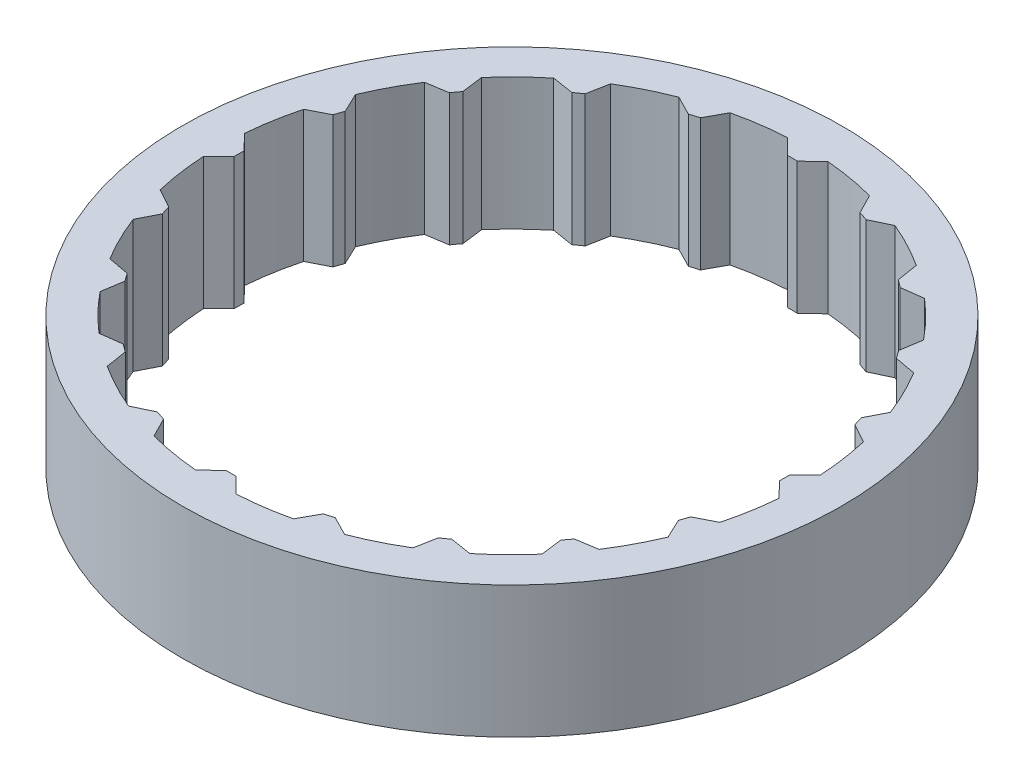
from build123d import *

# Parameters (mm, degrees)
SKETCH1_R           = 62.5
BOSS_EXTRUDE1_DEPTH = 25
CAVITY1_DEPTH       = 25


# Read off the part's stored shape, not the designer's step: Cavity1
with BuildPart() as part:
    # Sketch1 → Boss-Extrude1 (new body)
    with BuildSketch(Plane(origin=(0, 0, 0), x_dir=(1, 0, 0), z_dir=(0, 1, 0))):
        with Locations(Location((0, 0, 0), (0, 0, 270))):
            Circle(SKETCH1_R)
    extrude(amount=BOSS_EXTRUDE1_DEPTH)

    # Cavity1 outline → Cavity1 (cut)
    with BuildSketch(Plane(origin=(0, 0, 0), x_dir=(1, 0, 0), z_dir=(0, 1, 0))):
        with BuildLine():
            Line((16.350867892, -49.873660473), (20.022970331, -51.745036944))
            ThreePointArc((20.022970331, -51.745036944), (24.456878574, -49.800038203), (28.704396647, -47.476000203))
            Line((28.704396647, -47.476000203), (29.464309883, -43.425207924))
            ThreePointArc((29.464309883, -43.425207924), (30.217762384, -42.903777412), (30.961999914, -42.369276757))
            Line((30.961999914, -42.369276757), (35.032663999, -43.014319485))
            ThreePointArc((35.032663999, -43.014319485), (38.648523661, -39.79436276), (41.969986165, -36.271516008))
            Line((41.969986165, -36.271516008), (41.440942946, -32.18415751))
            ThreePointArc((41.440942946, -32.18415751), (41.996387967, -31.455417996), (42.539030133, -30.717095621))
            Line((42.539030133, -30.717095621), (46.609790903, -30.07266333))
            ThreePointArc((46.609790903, -30.07266333), (49.053656447, -25.89294042), (51.12393549, -21.5161257))
            Line((51.12393549, -21.5161257), (49.357722251, -17.792300112))
            ThreePointArc((49.357722251, -17.792300112), (49.660788964, -16.927585698), (49.94871817, -16.05771374))
            Line((49.94871817, -16.05771374), (53.621101197, -14.186887953))
            ThreePointArc((53.621101197, -14.186887953), (54.653750036, -9.456539258), (55.270192281, -4.654189691))
            Line((55.270192281, -4.654189691), (52.43969828, -1.658411006))
            ThreePointArc((52.43969828, -1.658411006), (52.460720403, -0.742365963), (52.465752134, 0.173906448))
            Line((52.465752134, 0.173906448), (55.380278979, 3.087996269))
            ThreePointArc((55.380278979, 3.087996269), (54.900628251, 7.905931261), (54.002892036, 12.66372824))
            Line((54.002892036, 12.66372824), (50.385185747, 14.63821233))
            ThreePointArc((50.385185747, 14.63821233), (50.122105488, 15.515919131), (49.843747202, 16.388900869))
            Line((49.843747202, 16.388900869), (51.715123672, 20.061003308))
            ThreePointArc((51.715123672, 20.061003308), (49.770124931, 24.49491155), (47.446086932, 28.742429624))
            Line((47.446086932, 28.742429624), (43.395294653, 29.50234286))
            ThreePointArc((43.395294653, 29.50234286), (42.87386414, 30.255795361), (42.339363485, 31.000032891))
            Line((42.339363485, 31.000032891), (42.984406214, 35.070696976))
            ThreePointArc((42.984406214, 35.070696976), (39.764449489, 38.686556638), (36.241602736, 42.008019142))
            Line((36.241602736, 42.008019142), (32.154244239, 41.478975923))
            ThreePointArc((32.154244239, 41.478975923), (31.425504725, 42.034420944), (30.68718235, 42.57706311))
            Line((30.68718235, 42.57706311), (30.042750059, 46.64782388))
            ThreePointArc((30.042750059, 46.64782388), (25.863027148, 49.091689424), (21.486212429, 51.161968467))
            Line((21.486212429, 51.161968467), (17.762386841, 49.395755228))
            ThreePointArc((17.762386841, 49.395755228), (16.897672427, 49.698821941), (16.027800469, 49.986751147))
            Line((16.027800469, 49.986751147), (14.156974682, 53.659134174))
            ThreePointArc((14.156974682, 53.659134174), (9.426625987, 54.691783013), (4.62427642, 55.308225258))
            Line((4.62427642, 55.308225258), (1.628497735, 52.477731257))
            ThreePointArc((1.628497735, 52.477731257), (0.712452692, 52.49875338), (-0.20381972, 52.503785111))
            Line((-0.20381972, 52.503785111), (-3.11790954, 55.418311956))
            ThreePointArc((-3.11790954, 55.418311956), (-7.935844532, 54.938661228), (-12.693641511, 54.040925013))
            Line((-12.693641511, 54.040925013), (-14.668125602, 50.423218724))
            ThreePointArc((-14.668125602, 50.423218724), (-15.545832402, 50.160138465), (-16.41881414, 49.881780179))
            Line((-16.41881414, 49.881780179), (-20.090916579, 51.753156649))
            ThreePointArc((-20.090916579, 51.753156649), (-24.524824822, 49.808157908), (-28.772342895, 47.484119909))
            Line((-28.772342895, 47.484119909), (-29.532256132, 43.43332763))
            ThreePointArc((-29.532256132, 43.43332763), (-30.285708633, 42.911897117), (-31.029946162, 42.377396462))
            Line((-31.029946162, 42.377396462), (-35.100610248, 43.022439191))
            ThreePointArc((-35.100610248, 43.022439191), (-38.71646991, 39.802482465), (-42.037932414, 36.279635713))
            Line((-42.037932414, 36.279635713), (-41.508889194, 32.192277216))
            ThreePointArc((-41.508889194, 32.192277216), (-42.064334215, 31.463537702), (-42.606976382, 30.725215327))
            Line((-42.606976382, 30.725215327), (-46.677737151, 30.080783036))
            ThreePointArc((-46.677737151, 30.080783036), (-49.121602695, 25.901060125), (-51.191881738, 21.524245406))
            Line((-51.191881738, 21.524245406), (-49.425668499, 17.800419818))
            ThreePointArc((-49.425668499, 17.800419818), (-49.728735212, 16.935705404), (-50.016664419, 16.065833446))
            Line((-50.016664419, 16.065833446), (-53.689047445, 14.195007659))
            ThreePointArc((-53.689047445, 14.195007659), (-54.721696284, 9.464658964), (-55.33813853, 4.662309397))
            Line((-55.33813853, 4.662309397), (-52.507644528, 1.666530712))
            ThreePointArc((-52.507644528, 1.666530712), (-52.528666651, 0.750485669), (-52.533698382, -0.165786743))
            Line((-52.533698382, -0.165786743), (-55.448225228, -3.079876563))
            ThreePointArc((-55.448225228, -3.079876563), (-54.968574499, -7.897811555), (-54.070838284, -12.655608534))
            Line((-54.070838284, -12.655608534), (-50.453131995, -14.630092625))
            ThreePointArc((-50.453131995, -14.630092625), (-50.190051736, -15.507799425), (-49.91169345, -16.380781163))
            Line((-49.91169345, -16.380781163), (-51.783069921, -20.052883602))
            ThreePointArc((-51.783069921, -20.052883602), (-49.83807118, -24.486791845), (-47.51403318, -28.734309918))
            Line((-47.51403318, -28.734309918), (-43.463240901, -29.494223155))
            ThreePointArc((-43.463240901, -29.494223155), (-42.941810389, -30.247675656), (-42.407309734, -30.991913185))
            Line((-42.407309734, -30.991913185), (-43.052352462, -35.062577271))
            ThreePointArc((-43.052352462, -35.062577271), (-39.832395737, -38.678436932), (-36.309548985, -41.999899437))
            Line((-36.309548985, -41.999899437), (-32.222190487, -41.470856217))
            ThreePointArc((-32.222190487, -41.470856217), (-31.493450973, -42.026301238), (-30.755128598, -42.568943405))
            Line((-30.755128598, -42.568943405), (-30.110696307, -46.639704174))
            ThreePointArc((-30.110696307, -46.639704174), (-25.930973397, -49.083569718), (-21.554158677, -51.153848761))
            Line((-21.554158677, -51.153848761), (-17.830333089, -49.387635522))
            ThreePointArc((-17.830333089, -49.387635522), (-16.965618675, -49.690702235), (-16.095746717, -49.978631442))
            Line((-16.095746717, -49.978631442), (-14.22492093, -53.651014468))
            ThreePointArc((-14.22492093, -53.651014468), (-9.494572235, -54.683663307), (-4.692222668, -55.300105553))
            Line((-4.692222668, -55.300105553), (-1.696443983, -52.469611551))
            ThreePointArc((-1.696443983, -52.469611551), (-0.78039894, -52.490633674), (0.135873471, -52.495665405))
            Line((0.135873471, -52.495665405), (3.049963292, -55.410192251))
            ThreePointArc((3.049963292, -55.410192251), (7.867898284, -54.930541522), (12.625695263, -54.032805307))
            Line((12.625695263, -54.032805307), (14.600179353, -50.415099018))
            ThreePointArc((14.600179353, -50.415099018), (15.477886154, -50.152018759), (16.350867892, -49.873660473))
        make_face()
    extrude(amount=CAVITY1_DEPTH, mode=Mode.SUBTRACT)


solid = part.part
